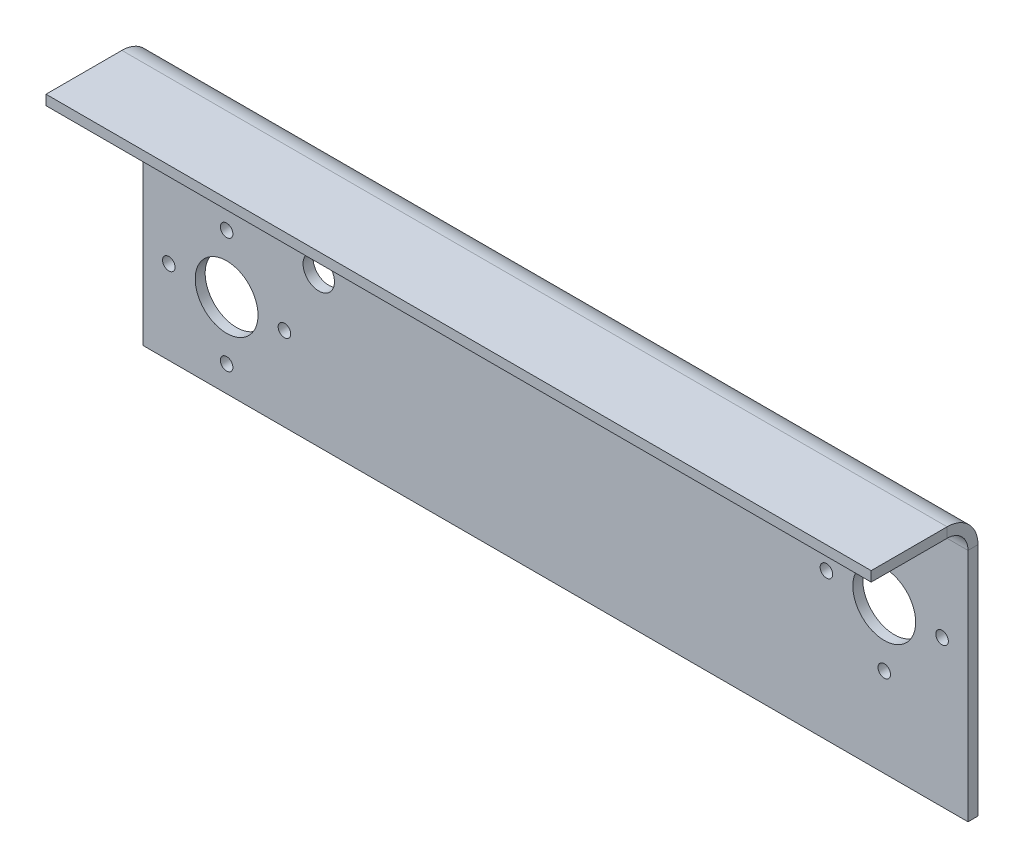
from build123d import *

# Parameters (mm, degrees)
CROQUIS1_W                       = 394
CROQUIS1_H                       = 127
CROQUIS1_R                       = 15
SALIENTE_EXTRUIR1_DEPTH          = 4.7625
CROQUIS2_R                       = 3
CORTAR_EXTRUIR1_DEPTH            = 365.565057851
CROQUIS3_R                       = 3
CORTAR_EXTRUIR2_DEPTH            = 365.565057851
MATRIZC1_COUNT                   = 4
BRIDA_DE_ARISTA1_STRIP_W         = 39.05
BRIDA_DE_ARISTA1_STRIP_H         = 4.7625
BRIDA_DE_ARISTA1_STRIP_CUT_DEPTH = 394
BRIDA_DE_ARISTA1_DEPTH           = 394
CORTAR_EXTRUIR3_DEPTH            = 369.084229491
CROQUIS15_R                      = 7.5
CORTAR_EXTRUIR4_DEPTH            = 369.084229491
CROQUIS16_R                      = 8
CORTAR_EXTRUIR5_DEPTH            = 369.084229491


# Sheet-metal steps are written as plain solids
with BuildPart() as part:
    # Croquis1 → Saliente-Extruir1 (new body)
    with BuildSketch(Plane.XY):
        with Locations((157, 23.5)):
            Rectangle(CROQUIS1_W, CROQUIS1_H)
        with Locations(Location((0, 0, 0), (0, 0, 180))):
            Circle(CROQUIS1_R, mode=Mode.SUBTRACT)
        with Locations(Location((314, 30, 0), (0, 0, 180))):
            Circle(CROQUIS1_R, mode=Mode.SUBTRACT)
    extrude(amount=SALIENTE_EXTRUIR1_DEPTH)

    # Croquis2 → Cortar-Extruir1 (cut, through all)
    with BuildSketch(Plane.XY.offset(4.7625)):
        with Locations((0, 27.597586589)):
            Circle(CROQUIS2_R)
        with Locations((27.597586589, 0)):
            Circle(CROQUIS2_R)
        with Locations((0, -27.597586589)):
            Circle(CROQUIS2_R)
        with Locations((-27.597586589, 0)):
            Circle(CROQUIS2_R)
    extrude(amount=-CORTAR_EXTRUIR1_DEPTH, mode=Mode.SUBTRACT)

    # Croquis3 → Cortar-Extruir2 (cut, through all)
    with BuildSketch(Plane.XY.offset(4.7625)):
        with Locations((314, 57.6)):
            Circle(CROQUIS3_R)
    cortar_extruir2 = extrude(amount=-CORTAR_EXTRUIR2_DEPTH, mode=Mode.SUBTRACT)

    # MatrizC1: Cortar-Extruir2 ×4 about axis
    matrizc1_axis = Axis((314, 30, 0), (0, 0, 1))
    for i in range(1, MATRIZC1_COUNT):
        add(cortar_extruir2.rotate(matrizc1_axis, i * 360 / MATRIZC1_COUNT), mode=Mode.SUBTRACT)

    # Brida de arista1 strip (across the edge) → Brida de arista1 strip cut (cut)
    with BuildSketch(Plane(origin=(354, 87, 4.7625), x_dir=(0, -1, 0), z_dir=(-1, 0, 0))):
        with Locations((-4.7625, -2.38125)):
            Rectangle(BRIDA_DE_ARISTA1_STRIP_W, BRIDA_DE_ARISTA1_STRIP_H)
    extrude(amount=BRIDA_DE_ARISTA1_STRIP_CUT_DEPTH, mode=Mode.SUBTRACT)

    # Brida de arista1 section (across the edge) → Brida de arista1 (add)
    with BuildSketch(Plane(origin=(354, 87, 4.7625), x_dir=(0, -1, 0), z_dir=(-1, 0, 0))):
        with BuildLine():
            Line((0, 10), (0, 46.2375))
            Line((0, 46.2375), (4.7625, 46.2375))
            Line((4.7625, 46.2375), (4.7625, 10))
            ThreePointArc((4.7625, 10), (7.691432188, 2.928932188), (14.7625, 0))
            Line((14.7625, 0), (14.7625, -4.7625))
            ThreePointArc((14.7625, -4.7625), (4.323836143, -0.438663857), (0, 10))
        make_face()
    extrude(amount=BRIDA_DE_ARISTA1_DEPTH)

    # Croquis14 → Cortar-Extruir3 (cut, through all)
    with BuildSketch(Plane(origin=(0, 0, 0), x_dir=(-1, 0, 0), z_dir=(0, 0, -1))):
        with BuildLine():
            Line((-7, 59), (-161, 59))
            ThreePointArc((-161, 59), (-166, 64), (-161, 69))
            Line((-161, 69), (-7, 69))
            ThreePointArc((-7, 69), (-2, 64), (-7, 59))
        make_face()
    extrude(amount=-CORTAR_EXTRUIR3_DEPTH, mode=Mode.SUBTRACT)

    # Croquis15 → Cortar-Extruir4 (cut, through all)
    with BuildSketch(Plane(origin=(0, 0, 0), x_dir=(-1, 0, 0), z_dir=(0, 0, -1))):
        with Locations((-44, 32)):
            Circle(CROQUIS15_R)
    extrude(amount=-CORTAR_EXTRUIR4_DEPTH, mode=Mode.SUBTRACT)

    # Croquis16 → Cortar-Extruir5 (cut, through all)
    with BuildSketch(Plane(origin=(0, 0, 0), x_dir=(-1, 0, 0), z_dir=(0, 0, -1))):
        with Locations((-276, 64)):
            Circle(CROQUIS16_R)
    extrude(amount=-CORTAR_EXTRUIR5_DEPTH, mode=Mode.SUBTRACT)


solid = part.part
